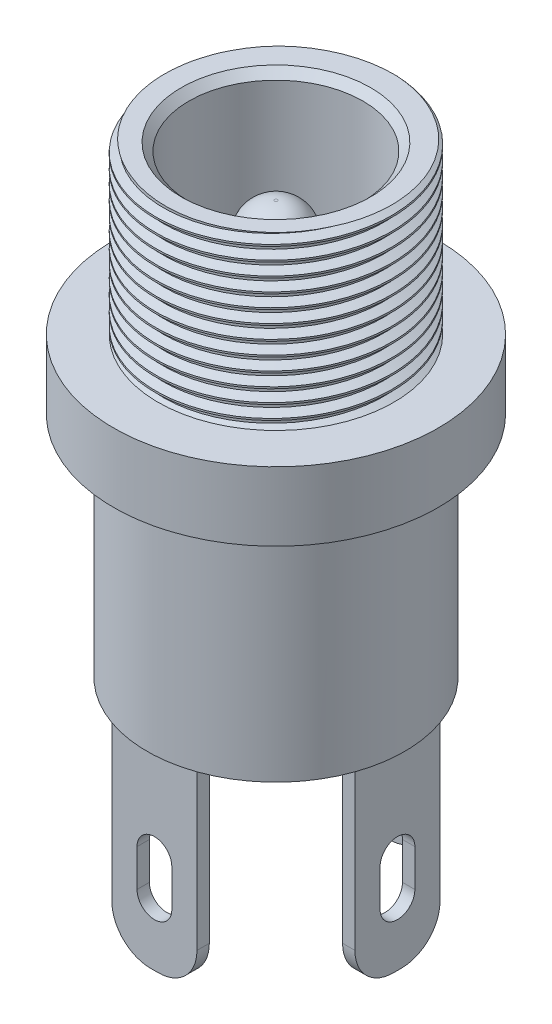
from build123d import *

# Parameters (mm, degrees)
SKETCH1_R               = 3.8735
SKETCH1_R_2             = 2.8575
BOSS_EXTRUDE1_DEPTH     = 5.461
CHAMFER1_SIZE           = 0.254
SKETCH2_R               = 5.334
BOSS_EXTRUDE2_DEPTH     = 2.2606
SKETCH3_R               = 4.2291
BOSS_EXTRUDE3_DEPTH     = 7.493
CUT_EXTRUDE1_START      = -11
SKETCH4_R               = 2.8575
CUT_EXTRUDE1_DEPTH      = 11
SKETCH5_R               = 1.05
BOSS_EXTRUDE4_DEPTH     = 9.349
FILLET1_R               = 1
SKETCH6_W               = 2.794
SKETCH6_H               = 0.4064
SKETCH6_W_2             = 0.4064
SKETCH6_H_2             = 2.794
BOSS_EXTRUDE5_DEPTH     = 6.35
CUT_EXTRUDE2_DEPTH      = 18.78283006
CUT_EXTRUDE3_DEPTH      = 18.78283006
CUT_EXTRUDE3_DEPTH_BACK = 18.78283006
FILLET2_R               = 1.27
THREAD1_PITCH           = 0.45


with BuildPart() as part:
    # Sketch1 → Boss-Extrude1 (new body)
    with BuildSketch(Plane(origin=(0, 0, 0), x_dir=(1, 0, 0), z_dir=(0, 1, 0))):
        with Locations(Location((0, 0, 0), (0, 0, 270))):
            Circle(SKETCH1_R)
        with Locations(Location((0, 0, 0), (0, 0, 270))):
            Circle(SKETCH1_R_2, mode=Mode.SUBTRACT)
    extrude(amount=BOSS_EXTRUDE1_DEPTH)

    # Chamfer1
    chamfer1_edges = [part.edges().sort_by_distance(p)[0] for p in [
        (0, 5.461, -2.8575),
    ]]
    chamfer(chamfer1_edges, length=CHAMFER1_SIZE)

    # Sketch2 → Boss-Extrude2 (add)
    with BuildSketch(Plane.XZ):
        with Locations(Location((0, 0, 0), (0, 0, 270))):
            Circle(SKETCH2_R)
    extrude(amount=BOSS_EXTRUDE2_DEPTH)

    # Sketch3 → Boss-Extrude3 (add)
    with BuildSketch(Plane.XZ.offset(2.2606)):
        with Locations(Location((0, 0, 0), (0, 0, 270))):
            Circle(SKETCH3_R)
    extrude(amount=BOSS_EXTRUDE3_DEPTH)

    # Sketch4 → Cut-Extrude1 (cut)
    with BuildSketch(Plane(origin=(0, 5.461, 0), x_dir=(1, 0, 0), z_dir=(0, 1, 0)).offset(CUT_EXTRUDE1_START)):
        with Locations(Location((0, 0, 0), (0, 0, 270))):
            Circle(SKETCH4_R)
    extrude(amount=CUT_EXTRUDE1_DEPTH, mode=Mode.SUBTRACT)

    # Sketch5 → Boss-Extrude4 (add)
    with BuildSketch(Plane(origin=(0, -5.539, 0), x_dir=(1, 0, 0), z_dir=(0, 1, 0))):
        with Locations(Location((0, 0, 0), (0, 0, 270))):
            Circle(SKETCH5_R)
    extrude(amount=BOSS_EXTRUDE4_DEPTH)

    # Fillet1
    fillet1_edges = [part.edges().sort_by_distance(p)[0] for p in [
        (0, 3.81, -1.05),
    ]]
    fillet(fillet1_edges, radius=FILLET1_R)

    # Sketch6 → Boss-Extrude5 (add)
    with BuildSketch(Plane.XZ.offset(9.7536)):
        with Locations((0, 3.788501117)):
            Rectangle(SKETCH6_W, SKETCH6_H)
        with Locations((3.788501117, 0)):
            Rectangle(SKETCH6_W_2, SKETCH6_H_2)
        with Locations((0, -3.788501117)):
            Rectangle(SKETCH6_W, SKETCH6_H)
    extrude(amount=BOSS_EXTRUDE5_DEPTH)

    # Sketch7 → Cut-Extrude2 (cut, through all)
    with BuildSketch(Plane(origin=(0, 0, 0), x_dir=(0, 0, -1), z_dir=(1, 0, 0))):
        with BuildLine():
            Line((0.5715, -12.8651), (0.5715, -14.0843))
            ThreePointArc((0.5715, -14.0843), (0, -14.6558), (-0.5715, -14.0843))
            Line((-0.5715, -14.0843), (-0.5715, -12.8651))
            ThreePointArc((-0.5715, -12.8651), (0, -12.2936), (0.5715, -12.8651))
        make_face()
    extrude(amount=CUT_EXTRUDE2_DEPTH, mode=Mode.SUBTRACT)

    # Sketch8 → Cut-Extrude3 (cut, two sides: drawn at the far end of the back side and taken through both)
    with BuildSketch(Plane.XY.offset(-CUT_EXTRUDE3_DEPTH_BACK)):
        with BuildLine():
            Line((0.5715, -12.8651), (0.5715, -14.0843))
            ThreePointArc((0.5715, -14.0843), (0, -14.6558), (-0.5715, -14.0843))
            Line((-0.5715, -14.0843), (-0.5715, -12.8651))
            ThreePointArc((-0.5715, -12.8651), (0, -12.2936), (0.5715, -12.8651))
        make_face()
    extrude(amount=CUT_EXTRUDE3_DEPTH + CUT_EXTRUDE3_DEPTH_BACK, mode=Mode.SUBTRACT)

    # Fillet2
    fillet2_edges = [part.edges().sort_by_distance(p)[0] for p in [
        (-1.397, -16.1036, 3.788501117),
        (1.397, -16.1036, 3.788501117),
        (3.788501117, -16.1036, -1.397),
        (3.788501117, -16.1036, 1.397),
        (1.397, -16.1036, -3.788501117),
        (-1.397, -16.1036, -3.788501117),
    ]]
    fillet(fillet2_edges, radius=FILLET2_R)

    # Thread1: the profile of Thread Profile1 profile screwed along a right-hand helix of 13.546667 turns, 6 arcs to a turn; built about Z, then put on its axis
    thread1_z = Axis((0, 0, 0), (0, 0, 1))
    thread1_corners = [(3.8738, 0, -0.000173205), (3.8738, 0, 0.393923204), (3.629930356, 0, 0.253124999), (3.629930356, 0, 0.140624999)]
    with BuildLine(mode=Mode.PRIVATE) as thread1_profile:
        Line(thread1_corners[0], thread1_corners[1])
        Line(thread1_corners[1], thread1_corners[2])
        Line(thread1_corners[2], thread1_corners[3])
        Line(thread1_corners[3], thread1_corners[0])
    thread1_cap = Face(thread1_profile.wire())
    thread1_turn_angles = [0, 30, 60, 90, 120, 150, 180, 210, 240, 270, 300, 330, 360]
    thread1_turn_weights = [1, 0.8660254037844387, 1, 0.8660254037844387, 1, 0.8660254037844387, 1, 0.8660254037844387, 1, 0.8660254037844387, 1, 0.8660254037844387, 1]
    thread1_turn_rails = [Edge.make_bspline([Vector(p[0], p[1], 0).rotate(thread1_z, thread1_turn_angles[k]) / thread1_turn_weights[k] + Vector(0, 0, p[2] + THREAD1_PITCH * thread1_turn_angles[k] / 360) for k in range(13)], [0, 0, 0, 1, 1, 2, 2, 3, 3, 4, 4, 5, 5, 6, 6, 6], 2, thread1_turn_weights) for p in thread1_corners]
    thread1_turn_sides = [Face.make_surface_from_curves(thread1_turn_rails[p[0]], thread1_turn_rails[p[1]]) for p in [(0, 1), (1, 2), (2, 3), (3, 0)]]
    thread1_last_angles = [4680, 4710, 4740, 4770, 4800, 4830, 4860, 4868.4, 4876.8]
    thread1_last_weights = [1, 0.8660254037844387, 1, 0.8660254037844387, 1, 0.8660254037844387, 1, 0.9892723329629881, 1]
    thread1_last_rails = [Edge.make_bspline([Vector(p[0], p[1], 0).rotate(thread1_z, thread1_last_angles[k]) / thread1_last_weights[k] + Vector(0, 0, p[2] + THREAD1_PITCH * thread1_last_angles[k] / 360) for k in range(9)], [0, 0, 0, 1, 1, 2, 2, 3, 3, 4, 4, 4], 2, thread1_last_weights) for p in thread1_corners]
    thread1_last_sides = [Face.make_surface_from_curves(thread1_last_rails[p[0]], thread1_last_rails[p[1]]) for p in [(0, 1), (1, 2), (2, 3), (3, 0)]]
    thread1 = Plane(origin=(0, 5.969, 0), x_dir=(-1, 0, 0), z_dir=(0, -1, 0)) * Solid(Shell([*[p.moved(Location((0, 0, THREAD1_PITCH * i))) for i in range(13) for p in thread1_turn_sides], *thread1_last_sides, thread1_cap, thread1_cap.rotate(thread1_z, 4876.8).moved(Location((0, 0, THREAD1_PITCH * 4876.8 / 360)))]))
    add(thread1, mode=Mode.SUBTRACT)


solid = part.part
